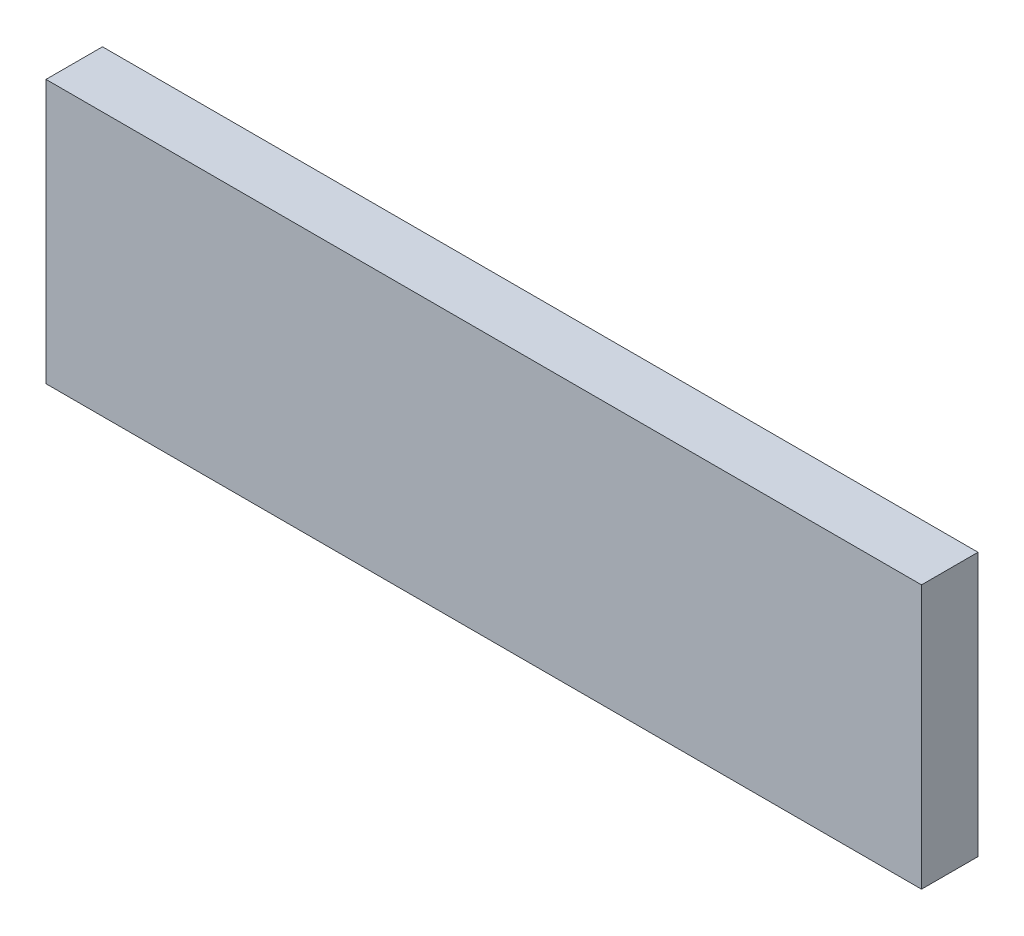
from build123d import *

# Parameters (mm, degrees)
SKETCH1_W           = 19.05
SKETCH1_H           = 88.9
BOSS_EXTRUDE1_DEPTH = 295.275


with BuildPart() as part:
    # Sketch1 → Boss-Extrude1 (new body)
    with BuildSketch(Plane(origin=(0, 0, 0), x_dir=(0, 0, -1), z_dir=(1, 0, 0))):
        Rectangle(SKETCH1_W, SKETCH1_H)
    extrude(amount=BOSS_EXTRUDE1_DEPTH)


solid = part.part
